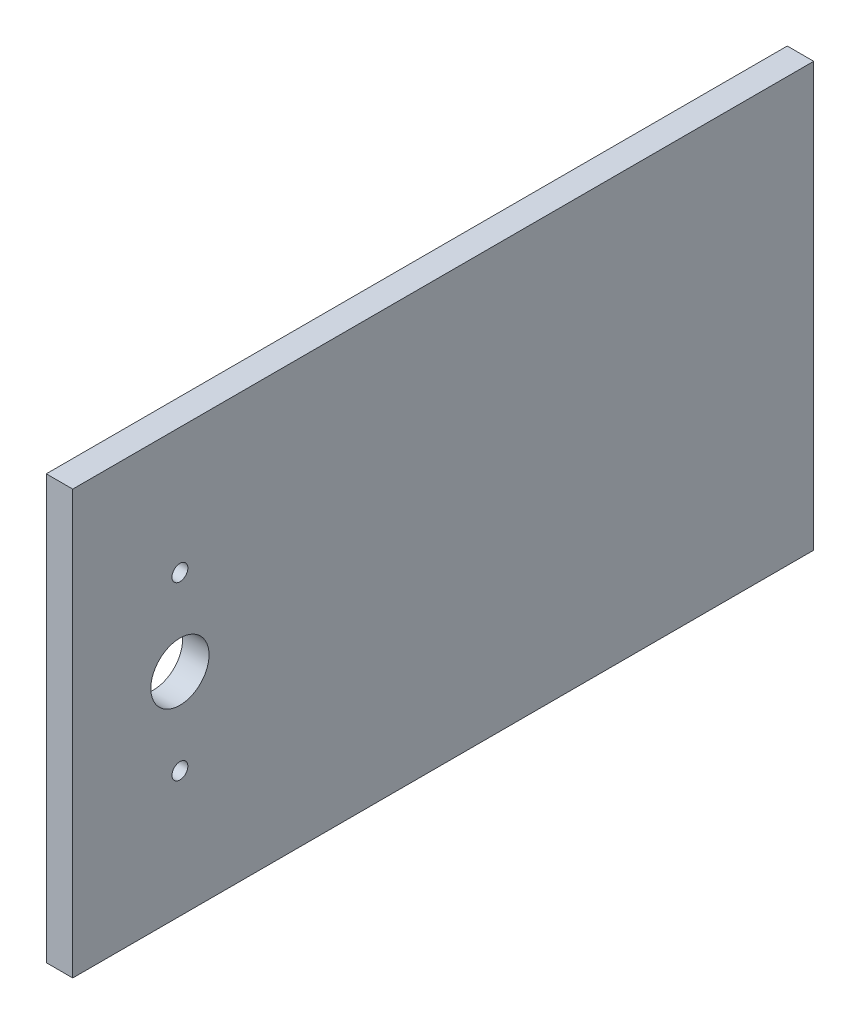
from build123d import *

# Parameters (mm, degrees)
SKETCH1_W           = 80
SKETCH1_H           = 140
SKETCH1_R           = 5.5
SKETCH1_R_2         = 1.5
BOSS_EXTRUDE1_DEPTH = 5


with BuildPart() as part:
    # Sketch1 → Boss-Extrude1 (new body)
    with BuildSketch(Plane.YZ):
        Rectangle(SKETCH1_W, SKETCH1_H)
        with Locations((0, 49.75)):
            Circle(SKETCH1_R, mode=Mode.SUBTRACT)
        with Locations((-16.22, 49.75)):
            Circle(SKETCH1_R_2, mode=Mode.SUBTRACT)
        with Locations((16.22, 49.75)):
            Circle(SKETCH1_R_2, mode=Mode.SUBTRACT)
    extrude(amount=BOSS_EXTRUDE1_DEPTH)


solid = part.part
